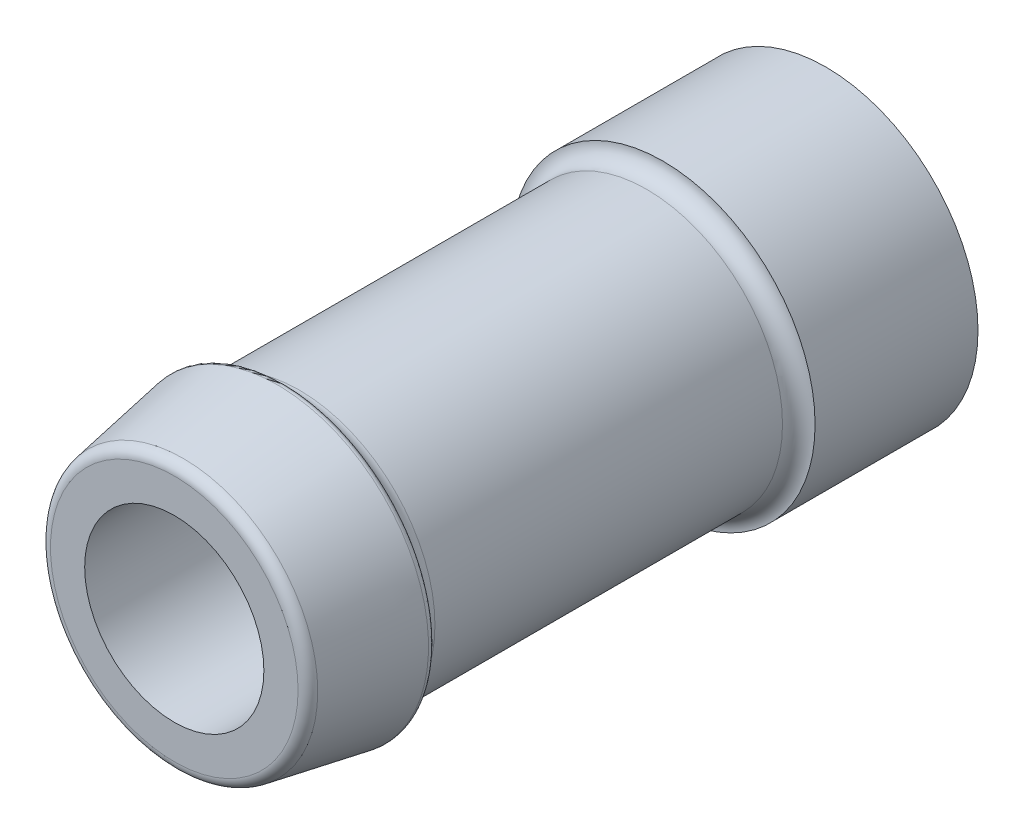
from build123d import *

# Parameters (mm, degrees)
SKETCH1_R           = 7.112
BOSS_EXTRUDE1_DEPTH = 30.48
SKETCH2_R           = 4.191
CUT_EXTRUDE1_DEPTH  = 30.48
CUT_EXTRUDE2_START  = -5.08
SKETCH3_R           = 7.874
SKETCH3_R_2         = 6.35
CUT_EXTRUDE2_DEPTH  = 17.78
FILLET1_R           = 0.762
FILLET2_R           = 0.762
CHAMFER1_SIZE       = 5.08
CHAMFER1_SIZE_2     = 0.895741062
FILLET3_R           = 0.508
FILLET4_R           = 0.254


# Some blends are built 0.0001 mm under size
with BuildPart() as part:
    # Sketch1 → Boss-Extrude1 (new body)
    with BuildSketch(Plane.XY):
        with Locations(Location((0, 0, 0), (0, 0, 180))):
            Circle(SKETCH1_R)
    extrude(amount=BOSS_EXTRUDE1_DEPTH)

    # Sketch2 → Cut-Extrude1 (cut)
    with BuildSketch(Plane.XY.offset(30.48)):
        Circle(SKETCH2_R)
    extrude(amount=-CUT_EXTRUDE1_DEPTH, mode=Mode.SUBTRACT)

    # Sketch3 → Cut-Extrude2 (cut)
    with BuildSketch(Plane.XY.offset(30.48).offset(CUT_EXTRUDE2_START)):
        Circle(SKETCH3_R)
        Circle(SKETCH3_R_2, mode=Mode.SUBTRACT)
    extrude(amount=-CUT_EXTRUDE2_DEPTH, mode=Mode.SUBTRACT)

    # Fillet1
    fillet1_edges = [part.edges().sort_by_distance(p)[0] for p in [
        (-6.35, 0, 7.62),
    ]]
    fillet(fillet1_edges, radius=FILLET1_R - 0.0001)  # a hair under: the kernel refuses the full size

    # Fillet2
    fillet2_edges = [part.edges().sort_by_distance(p)[0] for p in [
        (-6.35, 0, 25.4),
    ]]
    fillet(fillet2_edges, radius=FILLET2_R - 0.0001)  # a hair under: the kernel refuses the full size

    # Chamfer1
    # the kernel refuses this chamfer: 5.08, 0.895741062 mm, written as the material it takes off along each edge
    with BuildSketch(Plane(origin=(0, 0, 30.48), x_dir=(-1, 0, 0), z_dir=(0, 1, 0))) as chamfer1_piece_1:
        Polygon((7.112, -CHAMFER1_SIZE), (7.112 - CHAMFER1_SIZE_2, 0), (7.112, 0), align=None)
    revolve(axis=Axis((0, 0, 30.48), (0, 0, 1)), mode=Mode.SUBTRACT)

    # Fillet3
    fillet3_edges = [part.edges().sort_by_distance(p)[0] for p in [
        (6.216258938, 0, 30.48),
    ]]
    fillet(fillet3_edges, radius=FILLET3_R)

    # Fillet4
    fillet4_edges = [part.edges().sort_by_distance(p)[0] for p in [
        (7.112, 0, 25.4),
    ]]
    fillet(fillet4_edges, radius=FILLET4_R)


solid = part.part
